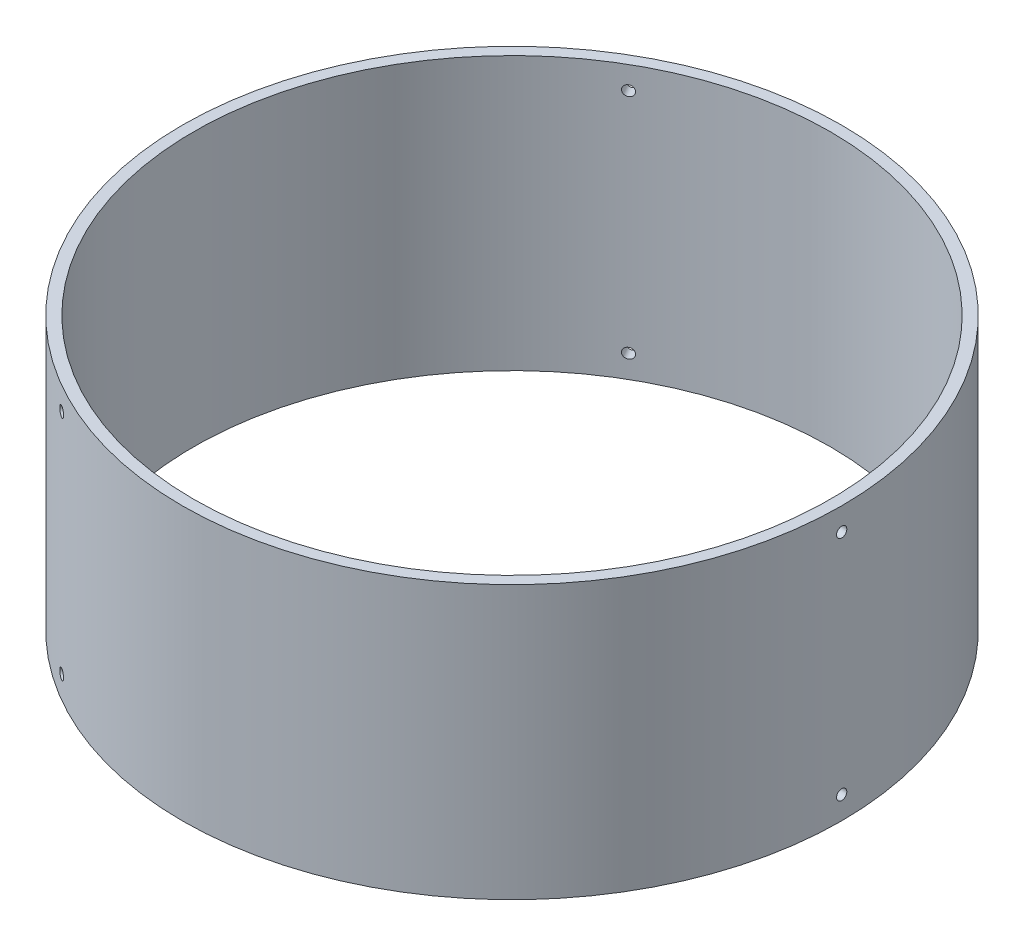
from build123d import *

# Parameters (mm, degrees)
SKETCH1_R           = 92.075
SKETCH1_R_2         = 88.9
BOSS_EXTRUDE1_DEPTH = 38.1
SKETCH3_R           = 1.4351
CUT_EXTRUDE1_DEPTH  = 34.798
CIRPATTERN1_COUNT   = 3


with BuildPart() as part:
    # Sketch1 → Boss-Extrude1 (new, symmetric)
    with BuildSketch(Plane(origin=(0, 0, 0), x_dir=(1, 0, 0), z_dir=(0, 1, 0))):
        Circle(SKETCH1_R)
        Circle(SKETCH1_R_2, mode=Mode.SUBTRACT)
    extrude(amount=BOSS_EXTRUDE1_DEPTH, both=True)

    # Sketch3 → Cut-Extrude1 (cut)
    with BuildSketch(Plane(origin=(92.075, 0, 0), x_dir=(0, 0, -1), z_dir=(1, 0, 0))):
        with Locations((0, -31.75)):
            Circle(SKETCH3_R)
        with Locations((0, 31.75)):
            Circle(SKETCH3_R)
    cut_extrude1 = extrude(amount=-CUT_EXTRUDE1_DEPTH, mode=Mode.SUBTRACT)

    # CirPattern1: Cut-Extrude1 ×3 about axis
    cirpattern1_axis = Axis((0, 38.1, 0), (0, -1, 0))
    for i in range(1, CIRPATTERN1_COUNT):
        add(cut_extrude1.rotate(cirpattern1_axis, i * 360 / CIRPATTERN1_COUNT), mode=Mode.SUBTRACT)


solid = part.part
